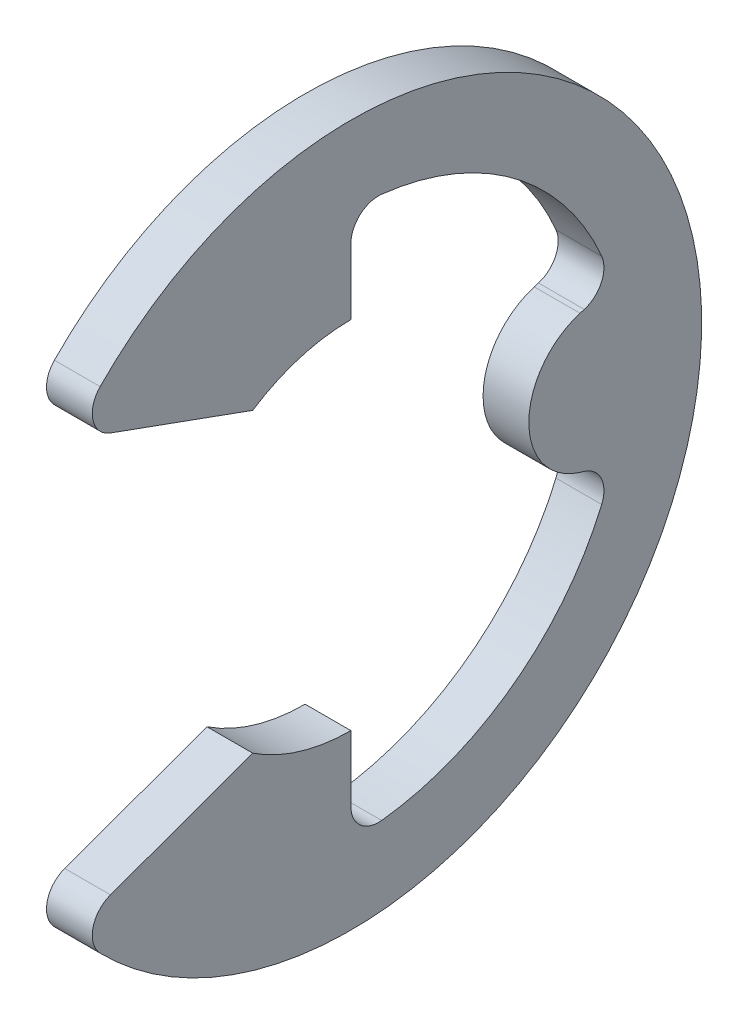
from build123d import *

# Parameters (mm, degrees)
EXTRUDE1_DEPTH = 0.45
FILLET2_START  = -0.45
FILLET2_DEPTH  = 0.9
FILLET1_R      = 0.544
SCALE1_SCALE   = 0.8


with BuildPart() as part:
    # Sketch1 → Extrude1 (new, symmetric)
    with BuildSketch(Plane(origin=(0, 0, 0), x_dir=(0, 0, -1), z_dir=(1, 0, 0))):
        with BuildLine():
            Line((-5.472300811, -4.20284711), (-1.929663183, -2.92))
            ThreePointArc((-1.929663183, -2.92), (-1.007472084, -3.351865152), (0, -3.5))
            Line((0, -3.5), (0, -5.367741935))
            ThreePointArc((0, -5.367741935), (3.203041928, -4.30733977), (5.140556326, -1.545100044))
            Line((5.140556326, -1.545100044), (3.351865152, -1.007472084))
            ThreePointArc((3.351865152, -1.007472084), (3.5, 0), (3.351865152, 1.007472084))
            Line((3.351865152, 1.007472084), (5.140556326, 1.545100044))
            ThreePointArc((5.140556326, 1.545100044), (3.203041928, 4.30733977), (0, 5.367741935))
            Line((0, 5.367741935), (0, 3.5))
            ThreePointArc((0, 3.5), (-1.007472084, 3.351865152), (-1.929663183, 2.92))
            Line((-1.929663183, 2.92), (-5.472300811, 4.20284711))
            ThreePointArc((-5.472300811, 4.20284711), (6.9, 0), (-5.472300811, -4.20284711))
        make_face()
    extrude(amount=EXTRUDE1_DEPTH, both=True)

    # Fillet2: read off the stored shape, not the designer's step
    # Fillet2 outline → Fillet2 (cut)
    with BuildSketch(Plane.YZ.offset(FILLET2_START)):
        with BuildLine():
            Line((-1.007472084, -3.351865152), (-1.35481354, -4.507472084))
            add(Edge.make_bspline(
                [(-1.35481354, -4.507472084), (-1.184355647, -3.940357738), (-0.701331375, -3.5), (0, -3.5)],
                knots=[0, 0, 0, 0, 0.5, 0.5, 0.5, 0.5], degree=3, weights=[1, 0.762616389, 0.643924583, 0.643924583]))
            ThreePointArc((0, -3.5), (-0.509152219, -3.462768259), (-1.007472084, -3.351865152))
        make_face()
        with BuildLine():
            ThreePointArc((1.007472084, -3.351865152), (0.509152221, -3.462768259), (2e-09, -3.5))
            add(Edge.make_bspline(
                [(2e-09, -3.5), (0.701331375, -3.5), (1.184355647, -3.940357738), (1.35481354, -4.507472084)],
                knots=[0.5, 0.5, 0.5, 0.5, 1, 1, 1, 1], degree=3, weights=[0.643924583, 0.643924583, 0.762616389, 1]))
            Line((1.35481354, -4.507472084), (1.007472084, -3.351865152))
        make_face()
    extrude(amount=FILLET2_DEPTH, mode=Mode.SUBTRACT)

    # Fillet1
    fillet1_edges = [part.edges().sort_by_distance(p)[0] for p in [
        (0, -5.367741935, 0),
        (0, 5.367741935, 0),
        (0, -4.20284711, 5.472300811),
        (0, 4.20284711, 5.472300811),
        (0, -1.545100044, -5.140556326),
        (0, 1.545100044, -5.140556326),
    ]]
    fillet(fillet1_edges, radius=FILLET1_R)


with BuildPart() as part_1:
    # Scale1: scaled about (0, 0, -1.222397064)
    add(part.part.scale(SCALE1_SCALE).moved(Location((0, 0, -0.244479413))))


solid = part_1.part
